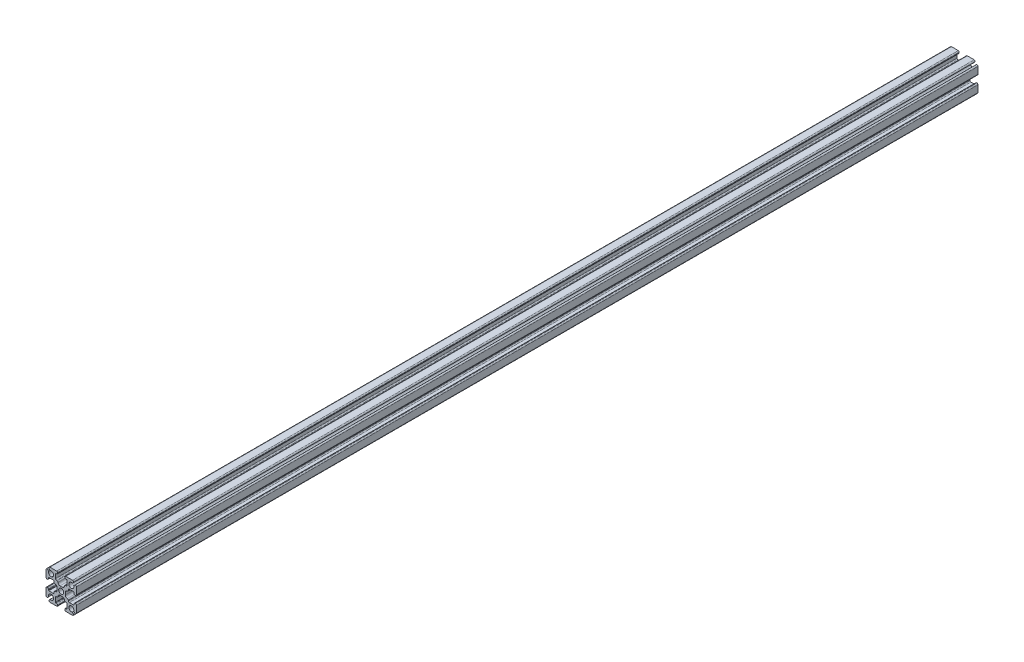
from build123d import *

# Parameters (mm, degrees)
SKETCH1_R           = 1.25
BOSS_EXTRUDE1_DEPTH = 444.5


with BuildPart() as part:
    # Sketch1 → Boss-Extrude1 (new body)
    with BuildSketch(Plane.XY):
        with BuildLine():
            Line((6.646446609, 5.939339828), (6.163645978, 5.456539197))
            ThreePointArc((6.163645978, 5.456539197), (4.116116524, 4.116116524), (5.456539197, 6.163645978))
            Line((5.456539197, 6.163645978), (5.939339828, 6.646446609))
            ThreePointArc((5.939339828, 6.646446609), (6.047726204, 7.191341716), (5.585786438, 7.5))
            Line((5.585786438, 7.5), (2.25, 7.5))
            ThreePointArc((2.25, 7.5), (1.896446609, 7.353553391), (1.75, 7))
            Line((1.75, 7), (1.75, 6.8))
            ThreePointArc((1.75, 6.8), (1.896446609, 6.446446609), (2.25, 6.3))
            Line((2.25, 6.3), (2.65, 6.3))
            ThreePointArc((2.65, 6.3), (2.791421356, 6.241421356), (2.85, 6.1))
            Line((2.85, 6.1), (2.85, 4))
            ThreePointArc((2.85, 4), (2.703553391, 3.646446609), (2.35, 3.5))
            Line((2.35, 3.5), (2.1, 3.5))
            ThreePointArc((2.1, 3.5), (1.746446609, 3.353553391), (1.6, 3))
            ThreePointArc((1.6, 3), (1.307106781, 2.292893219), (0.6, 2))
            Line((0.6, 2), (-0.6, 2))
            ThreePointArc((-0.6, 2), (-1.307106781, 2.292893219), (-1.6, 3))
            ThreePointArc((-1.6, 3), (-1.746446609, 3.353553391), (-2.1, 3.5))
            Line((-2.1, 3.5), (-2.35, 3.5))
            ThreePointArc((-2.35, 3.5), (-2.703553391, 3.646446609), (-2.85, 4))
            Line((-2.85, 4), (-2.85, 6.1))
            ThreePointArc((-2.85, 6.1), (-2.791421356, 6.241421356), (-2.65, 6.3))
            Line((-2.65, 6.3), (-2.25, 6.3))
            ThreePointArc((-2.25, 6.3), (-1.896446609, 6.446446609), (-1.75, 6.8))
            Line((-1.75, 6.8), (-1.75, 7))
            ThreePointArc((-1.75, 7), (-1.896446609, 7.353553391), (-2.25, 7.5))
            Line((-2.25, 7.5), (-5.585786438, 7.5))
            ThreePointArc((-5.585786438, 7.5), (-6.047726204, 7.191341716), (-5.939339828, 6.646446609))
            Line((-5.939339828, 6.646446609), (-5.456539197, 6.163645978))
            ThreePointArc((-5.456539197, 6.163645978), (-4.116116524, 4.116116524), (-6.163645978, 5.456539197))
            Line((-6.163645978, 5.456539197), (-6.646446609, 5.939339828))
            ThreePointArc((-6.646446609, 5.939339828), (-7.191341716, 6.047726204), (-7.5, 5.585786438))
            Line((-7.5, 5.585786438), (-7.5, 2.25))
            ThreePointArc((-7.5, 2.25), (-7.353553391, 1.896446609), (-7, 1.75))
            Line((-7, 1.75), (-6.8, 1.75))
            ThreePointArc((-6.8, 1.75), (-6.446446609, 1.896446609), (-6.3, 2.25))
            Line((-6.3, 2.25), (-6.3, 2.65))
            ThreePointArc((-6.3, 2.65), (-6.241421356, 2.791421356), (-6.1, 2.85))
            Line((-6.1, 2.85), (-4, 2.85))
            ThreePointArc((-4, 2.85), (-3.646446609, 2.703553391), (-3.5, 2.35))
            Line((-3.5, 2.35), (-3.5, 2.1))
            ThreePointArc((-3.5, 2.1), (-3.353553391, 1.746446609), (-3, 1.6))
            ThreePointArc((-3, 1.6), (-2.292893219, 1.307106781), (-2, 0.6))
            Line((-2, 0.6), (-2, -0.6))
            ThreePointArc((-2, -0.6), (-2.292893219, -1.307106781), (-3, -1.6))
            ThreePointArc((-3, -1.6), (-3.353553391, -1.746446609), (-3.5, -2.1))
            Line((-3.5, -2.1), (-3.5, -2.35))
            ThreePointArc((-3.5, -2.35), (-3.646446609, -2.703553391), (-4, -2.85))
            Line((-4, -2.85), (-6.1, -2.85))
            ThreePointArc((-6.1, -2.85), (-6.241421356, -2.791421356), (-6.3, -2.65))
            Line((-6.3, -2.65), (-6.3, -2.25))
            ThreePointArc((-6.3, -2.25), (-6.446446609, -1.896446609), (-6.8, -1.75))
            Line((-6.8, -1.75), (-7, -1.75))
            ThreePointArc((-7, -1.75), (-7.353553391, -1.896446609), (-7.5, -2.25))
            Line((-7.5, -2.25), (-7.5, -5.585786438))
            ThreePointArc((-7.5, -5.585786438), (-7.191341716, -6.047726204), (-6.646446609, -5.939339828))
            Line((-6.646446609, -5.939339828), (-6.163645978, -5.456539197))
            ThreePointArc((-6.163645978, -5.456539197), (-4.116116524, -4.116116524), (-5.456539197, -6.163645978))
            Line((-5.456539197, -6.163645978), (-5.939339828, -6.646446609))
            ThreePointArc((-5.939339828, -6.646446609), (-6.047726204, -7.191341716), (-5.585786438, -7.5))
            Line((-5.585786438, -7.5), (-2.25, -7.5))
            ThreePointArc((-2.25, -7.5), (-1.896446609, -7.353553391), (-1.75, -7))
            Line((-1.75, -7), (-1.75, -6.8))
            ThreePointArc((-1.75, -6.8), (-1.896446609, -6.446446609), (-2.25, -6.3))
            Line((-2.25, -6.3), (-2.65, -6.3))
            ThreePointArc((-2.65, -6.3), (-2.791421356, -6.241421356), (-2.85, -6.1))
            Line((-2.85, -6.1), (-2.85, -4))
            ThreePointArc((-2.85, -4), (-2.703553391, -3.646446609), (-2.35, -3.5))
            Line((-2.35, -3.5), (-2.1, -3.5))
            ThreePointArc((-2.1, -3.5), (-1.746446609, -3.353553391), (-1.6, -3))
            ThreePointArc((-1.6, -3), (-1.307106781, -2.292893219), (-0.6, -2))
            Line((-0.6, -2), (0.6, -2))
            ThreePointArc((0.6, -2), (1.307106781, -2.292893219), (1.6, -3))
            ThreePointArc((1.6, -3), (1.746446609, -3.353553391), (2.1, -3.5))
            Line((2.1, -3.5), (2.35, -3.5))
            ThreePointArc((2.35, -3.5), (2.703553391, -3.646446609), (2.85, -4))
            Line((2.85, -4), (2.85, -6.1))
            ThreePointArc((2.85, -6.1), (2.791421356, -6.241421356), (2.65, -6.3))
            Line((2.65, -6.3), (2.25, -6.3))
            ThreePointArc((2.25, -6.3), (1.896446609, -6.446446609), (1.75, -6.8))
            Line((1.75, -6.8), (1.75, -7))
            ThreePointArc((1.75, -7), (1.896446609, -7.353553391), (2.25, -7.5))
            Line((2.25, -7.5), (5.585786438, -7.5))
            ThreePointArc((5.585786438, -7.5), (6.047726204, -7.191341716), (5.939339828, -6.646446609))
            Line((5.939339828, -6.646446609), (5.456539197, -6.163645978))
            ThreePointArc((5.456539197, -6.163645978), (4.116116524, -4.116116524), (6.163645978, -5.456539197))
            Line((6.163645978, -5.456539197), (6.646446609, -5.939339828))
            ThreePointArc((6.646446609, -5.939339828), (7.191341716, -6.047726204), (7.5, -5.585786438))
            Line((7.5, -5.585786438), (7.5, -2.25))
            ThreePointArc((7.5, -2.25), (7.353553391, -1.896446609), (7, -1.75))
            Line((7, -1.75), (6.8, -1.75))
            ThreePointArc((6.8, -1.75), (6.446446609, -1.896446609), (6.3, -2.25))
            Line((6.3, -2.25), (6.3, -2.65))
            ThreePointArc((6.3, -2.65), (6.241421356, -2.791421356), (6.1, -2.85))
            Line((6.1, -2.85), (4, -2.85))
            ThreePointArc((4, -2.85), (3.646446609, -2.703553391), (3.5, -2.35))
            Line((3.5, -2.35), (3.5, -2.1))
            ThreePointArc((3.5, -2.1), (3.353553391, -1.746446609), (3, -1.6))
            ThreePointArc((3, -1.6), (2.292893219, -1.307106781), (2, -0.6))
            Line((2, -0.6), (2, 0.6))
            ThreePointArc((2, 0.6), (2.292893219, 1.307106781), (3, 1.6))
            ThreePointArc((3, 1.6), (3.353553391, 1.746446609), (3.5, 2.1))
            Line((3.5, 2.1), (3.5, 2.35))
            ThreePointArc((3.5, 2.35), (3.646446609, 2.703553391), (4, 2.85))
            Line((4, 2.85), (6.1, 2.85))
            ThreePointArc((6.1, 2.85), (6.241421356, 2.791421356), (6.3, 2.65))
            Line((6.3, 2.65), (6.3, 2.25))
            ThreePointArc((6.3, 2.25), (6.446446609, 1.896446609), (6.8, 1.75))
            Line((6.8, 1.75), (7, 1.75))
            ThreePointArc((7, 1.75), (7.353553391, 1.896446609), (7.5, 2.25))
            Line((7.5, 2.25), (7.5, 5.585786438))
            ThreePointArc((7.5, 5.585786438), (7.191341716, 6.047726204), (6.646446609, 5.939339828))
        make_face()
        Circle(SKETCH1_R, mode=Mode.SUBTRACT)
    extrude(amount=BOSS_EXTRUDE1_DEPTH)


solid = part.part
